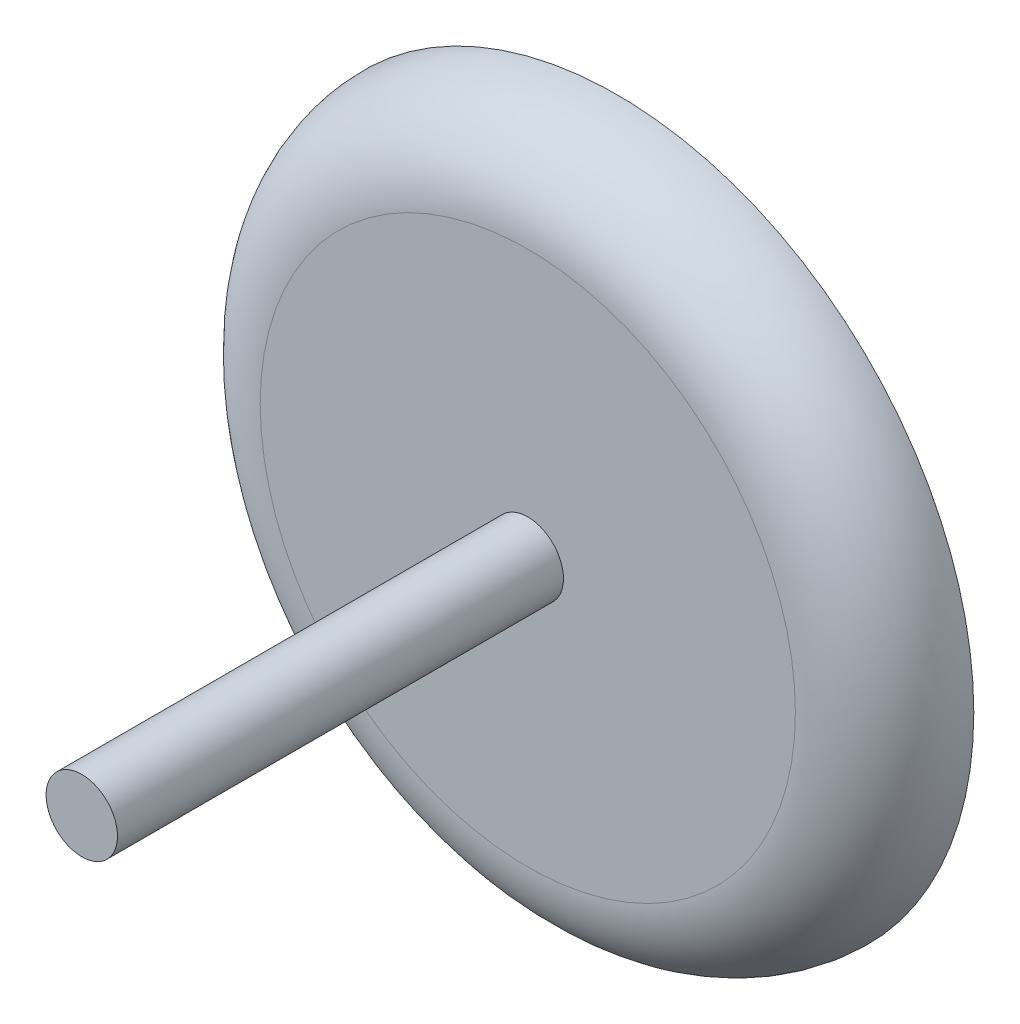
from build123d import *

# Parameters (mm, degrees)
ESQUISSE1_R        = 40
BOSS_EXTRU_1_DEPTH = 10
CONG_1_R           = 10
ESQUISSE2_R        = 4
BOSS_EXTRU_2_DEPTH = 50


with BuildPart() as part:
    # Esquisse1 → Boss.-Extru.1 (new body)
    with BuildSketch(Plane.XY):
        Circle(ESQUISSE1_R)
    extrude(amount=BOSS_EXTRU_1_DEPTH)

    # Congé1
    cong_1_edges = [part.edges().sort_by_distance(p)[0] for p in [
        (-40, 0, 10),
    ]]
    fillet(cong_1_edges, radius=CONG_1_R - 0.0001)  # a hair under: the kernel refuses the full size

    # Esquisse2 → Boss.-Extru.2 (add)
    with BuildSketch(Plane.XY.offset(10)):
        Circle(ESQUISSE2_R)
    extrude(amount=BOSS_EXTRU_2_DEPTH)


solid = part.part
